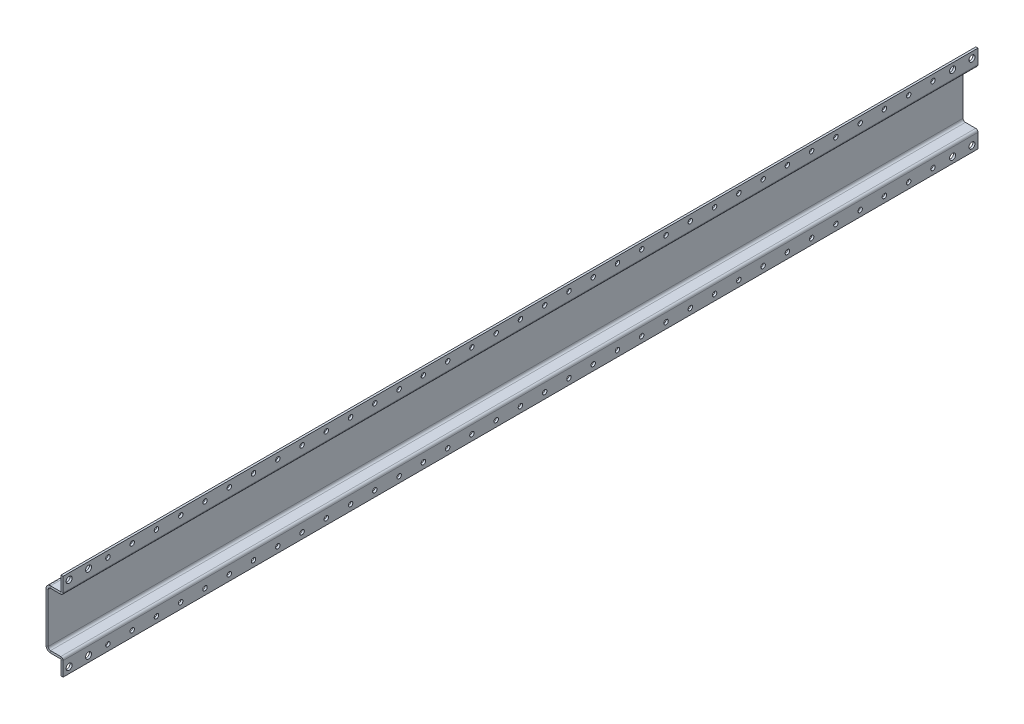
from build123d import *

# Parameters (mm, degrees)
BRIDA_BASE5_DEPTH     = 1197.102
CROQUIS22_R           = 3.937
CORTAR_EXTRUIR1_DEPTH = 54.102
CROQUIS23_R           = 2.921
CORTAR_EXTRUIR2_DEPTH = 54.102


# Sheet-metal steps are written as plain solids
with BuildPart() as part:
    # Croquis1 → Brida base5 (new body)
    with BuildSketch(Plane.XY):
        with BuildLine():
            Line((0, 21.844), (0, 3.048))
            ThreePointArc((0, 3.048), (-0.892738531, 0.892738531), (-3.048, 0))
            Line((-3.048, 0), (-16.51, 0))
            ThreePointArc((-16.51, 0), (-18.665261469, -0.892738531), (-19.558, -3.048))
            Line((-19.558, -3.048), (-19.558, -67.564))
            ThreePointArc((-19.558, -67.564), (-18.665261469, -69.719261469), (-16.51, -70.612))
            Line((-16.51, -70.612), (-3.048, -70.612))
            ThreePointArc((-3.048, -70.612), (-0.892738531, -71.504738531), (0, -73.66))
            Line((0, -73.66), (0, -92.456))
            Line((0, -92.456), (-2.794, -92.456))
            Line((-2.794, -92.456), (-2.794, -73.66))
            ThreePointArc((-2.794, -73.66), (-2.868394878, -73.480394878), (-3.048, -73.406))
            Line((-3.048, -73.406), (-16.51, -73.406))
            ThreePointArc((-16.51, -73.406), (-20.640917816, -71.694917816), (-22.352, -67.564))
            Line((-22.352, -67.564), (-22.352, -3.048))
            ThreePointArc((-22.352, -3.048), (-20.640917816, 1.082917816), (-16.51, 2.794))
            Line((-16.51, 2.794), (-3.048, 2.794))
            ThreePointArc((-3.048, 2.794), (-2.868394878, 2.868394878), (-2.794, 3.048))
            Line((-2.794, 3.048), (-2.794, 21.844))
            Line((-2.794, 21.844), (0, 21.844))
        make_face()
    extrude(amount=BRIDA_BASE5_DEPTH)

    # Croquis22 → Cortar-Extruir1 (cut)
    with BuildSketch(Plane(origin=(0, 0, 0), x_dir=(0, 0, -1), z_dir=(1, 0, 0))):
        with Locations(Location((-1189.228, 13.891549634, 0), (0, 0, 90))):
            Circle(CROQUIS22_R)
        with Locations(Location((-1163.828, 13.891549634, 0), (0, 0, 90))):
            Circle(CROQUIS22_R)
        with Locations(Location((-1189.228, -84.582, 0), (0, 0, 90))):
            Circle(CROQUIS22_R)
        with Locations(Location((-1163.828, -84.582, 0), (0, 0, 90))):
            Circle(CROQUIS22_R)
        with Locations(Location((-7.874, 13.891549634, 0), (0, 0, 90))):
            Circle(CROQUIS22_R)
        with Locations(Location((-33.274, 13.891549634, 0), (0, 0, 90))):
            Circle(CROQUIS22_R)
        with Locations(Location((-7.874, -84.582, 0), (0, 0, 90))):
            Circle(CROQUIS22_R)
        with Locations(Location((-33.274, -84.582, 0), (0, 0, 90))):
            Circle(CROQUIS22_R)
    extrude(amount=-CORTAR_EXTRUIR1_DEPTH, mode=Mode.SUBTRACT)

    # Croquis23 → Cortar-Extruir2 (cut)
    with BuildSketch(Plane(origin=(0, 0, 0), x_dir=(0, 0, -1), z_dir=(1, 0, 0))):
        with Locations(Location((-1138.428, 13.891549634, 0), (0, 0, 90))):
            Circle(CROQUIS23_R)
        with Locations(Location((-1138.428, -84.582, 0), (0, 0, 90))):
            Circle(CROQUIS23_R)
        with Locations(Location((-1106.678, 13.891549634, 0), (0, 0, 90))):
            Circle(CROQUIS23_R)
        with Locations(Location((-1106.678, -84.582, 0), (0, 0, 90))):
            Circle(CROQUIS23_R)
        with Locations(Location((-1074.928, 13.891549634, 0), (0, 0, 90))):
            Circle(CROQUIS23_R)
        with Locations(Location((-1074.928, -84.582, 0), (0, 0, 90))):
            Circle(CROQUIS23_R)
        with Locations(Location((-1043.178, 13.891549634, 0), (0, 0, 90))):
            Circle(CROQUIS23_R)
        with Locations(Location((-1043.178, -84.582, 0), (0, 0, 90))):
            Circle(CROQUIS23_R)
        with Locations(Location((-1011.428, 13.891549634, 0), (0, 0, 90))):
            Circle(CROQUIS23_R)
        with Locations(Location((-1011.428, -84.582, 0), (0, 0, 90))):
            Circle(CROQUIS23_R)
        with Locations(Location((-979.678, 13.891549634, 0), (0, 0, 90))):
            Circle(CROQUIS23_R)
        with Locations(Location((-979.678, -84.582, 0), (0, 0, 90))):
            Circle(CROQUIS23_R)
        with Locations(Location((-947.928, 13.891549634, 0), (0, 0, 90))):
            Circle(CROQUIS23_R)
        with Locations(Location((-947.928, -84.582, 0), (0, 0, 90))):
            Circle(CROQUIS23_R)
        with Locations(Location((-916.178, 13.891549634, 0), (0, 0, 90))):
            Circle(CROQUIS23_R)
        with Locations(Location((-916.178, -84.582, 0), (0, 0, 90))):
            Circle(CROQUIS23_R)
        with Locations(Location((-884.428, 13.891549634, 0), (0, 0, 90))):
            Circle(CROQUIS23_R)
        with Locations(Location((-884.428, -84.582, 0), (0, 0, 90))):
            Circle(CROQUIS23_R)
        with Locations(Location((-852.678, 13.891549634, 0), (0, 0, 90))):
            Circle(CROQUIS23_R)
        with Locations(Location((-852.678, -84.582, 0), (0, 0, 90))):
            Circle(CROQUIS23_R)
        with Locations(Location((-820.928, 13.891549634, 0), (0, 0, 90))):
            Circle(CROQUIS23_R)
        with Locations(Location((-820.928, -84.582, 0), (0, 0, 90))):
            Circle(CROQUIS23_R)
        with Locations(Location((-789.178, 13.891549634, 0), (0, 0, 90))):
            Circle(CROQUIS23_R)
        with Locations(Location((-789.178, -84.582, 0), (0, 0, 90))):
            Circle(CROQUIS23_R)
        with Locations(Location((-757.428, 13.891549634, 0), (0, 0, 90))):
            Circle(CROQUIS23_R)
        with Locations(Location((-757.428, -84.582, 0), (0, 0, 90))):
            Circle(CROQUIS23_R)
        with Locations(Location((-725.678, 13.891549634, 0), (0, 0, 90))):
            Circle(CROQUIS23_R)
        with Locations(Location((-725.678, -84.582, 0), (0, 0, 90))):
            Circle(CROQUIS23_R)
        with Locations(Location((-693.928, 13.891549634, 0), (0, 0, 90))):
            Circle(CROQUIS23_R)
        with Locations(Location((-693.928, -84.582, 0), (0, 0, 90))):
            Circle(CROQUIS23_R)
        with Locations(Location((-662.178, 13.891549634, 0), (0, 0, 90))):
            Circle(CROQUIS23_R)
        with Locations(Location((-662.178, -84.582, 0), (0, 0, 90))):
            Circle(CROQUIS23_R)
        with Locations(Location((-630.428, 13.891549634, 0), (0, 0, 90))):
            Circle(CROQUIS23_R)
        with Locations(Location((-630.428, -84.582, 0), (0, 0, 90))):
            Circle(CROQUIS23_R)
        with Locations(Location((-598.678, 13.891549634, 0), (0, 0, 90))):
            Circle(CROQUIS23_R)
        with Locations(Location((-598.678, -84.582, 0), (0, 0, 90))):
            Circle(CROQUIS23_R)
        with Locations(Location((-566.928, 13.891549634, 0), (0, 0, 90))):
            Circle(CROQUIS23_R)
        with Locations(Location((-566.928, -84.582, 0), (0, 0, 90))):
            Circle(CROQUIS23_R)
        with Locations(Location((-535.178, 13.891549634, 0), (0, 0, 90))):
            Circle(CROQUIS23_R)
        with Locations(Location((-535.178, -84.582, 0), (0, 0, 90))):
            Circle(CROQUIS23_R)
        with Locations(Location((-503.428, 13.891549634, 0), (0, 0, 90))):
            Circle(CROQUIS23_R)
        with Locations(Location((-503.428, -84.582, 0), (0, 0, 90))):
            Circle(CROQUIS23_R)
        with Locations(Location((-471.678, 13.891549634, 0), (0, 0, 90))):
            Circle(CROQUIS23_R)
        with Locations(Location((-471.678, -84.582, 0), (0, 0, 90))):
            Circle(CROQUIS23_R)
        with Locations(Location((-439.928, 13.891549634, 0), (0, 0, 90))):
            Circle(CROQUIS23_R)
        with Locations(Location((-439.928, -84.582, 0), (0, 0, 90))):
            Circle(CROQUIS23_R)
        with Locations(Location((-408.178, 13.891549634, 0), (0, 0, 90))):
            Circle(CROQUIS23_R)
        with Locations(Location((-408.178, -84.582, 0), (0, 0, 90))):
            Circle(CROQUIS23_R)
        with Locations(Location((-376.428, 13.891549634, 0), (0, 0, 90))):
            Circle(CROQUIS23_R)
        with Locations(Location((-376.428, -84.582, 0), (0, 0, 90))):
            Circle(CROQUIS23_R)
        with Locations(Location((-344.678, 13.891549634, 0), (0, 0, 90))):
            Circle(CROQUIS23_R)
        with Locations(Location((-344.678, -84.582, 0), (0, 0, 90))):
            Circle(CROQUIS23_R)
        with Locations(Location((-312.928, 13.891549634, 0), (0, 0, 90))):
            Circle(CROQUIS23_R)
        with Locations(Location((-312.928, -84.582, 0), (0, 0, 90))):
            Circle(CROQUIS23_R)
        with Locations(Location((-281.178, 13.891549634, 0), (0, 0, 90))):
            Circle(CROQUIS23_R)
        with Locations(Location((-281.178, -84.582, 0), (0, 0, 90))):
            Circle(CROQUIS23_R)
        with Locations(Location((-249.428, 13.891549634, 0), (0, 0, 90))):
            Circle(CROQUIS23_R)
        with Locations(Location((-249.428, -84.582, 0), (0, 0, 90))):
            Circle(CROQUIS23_R)
        with Locations(Location((-217.678, 13.891549634, 0), (0, 0, 90))):
            Circle(CROQUIS23_R)
        with Locations(Location((-217.678, -84.582, 0), (0, 0, 90))):
            Circle(CROQUIS23_R)
        with Locations(Location((-185.928, 13.891549634, 0), (0, 0, 90))):
            Circle(CROQUIS23_R)
        with Locations(Location((-185.928, -84.582, 0), (0, 0, 90))):
            Circle(CROQUIS23_R)
        with Locations(Location((-154.178, 13.891549634, 0), (0, 0, 90))):
            Circle(CROQUIS23_R)
        with Locations(Location((-154.178, -84.582, 0), (0, 0, 90))):
            Circle(CROQUIS23_R)
        with Locations(Location((-122.428, 13.891549634, 0), (0, 0, 90))):
            Circle(CROQUIS23_R)
        with Locations(Location((-122.428, -84.582, 0), (0, 0, 90))):
            Circle(CROQUIS23_R)
        with Locations(Location((-90.678, 13.891549634, 0), (0, 0, 90))):
            Circle(CROQUIS23_R)
        with Locations(Location((-90.678, -84.582, 0), (0, 0, 90))):
            Circle(CROQUIS23_R)
        with Locations(Location((-58.928, 13.891549634, 0), (0, 0, 90))):
            Circle(CROQUIS23_R)
        with Locations(Location((-58.928, -84.582, 0), (0, 0, 90))):
            Circle(CROQUIS23_R)
    extrude(amount=-CORTAR_EXTRUIR2_DEPTH, mode=Mode.SUBTRACT)


solid = part.part
